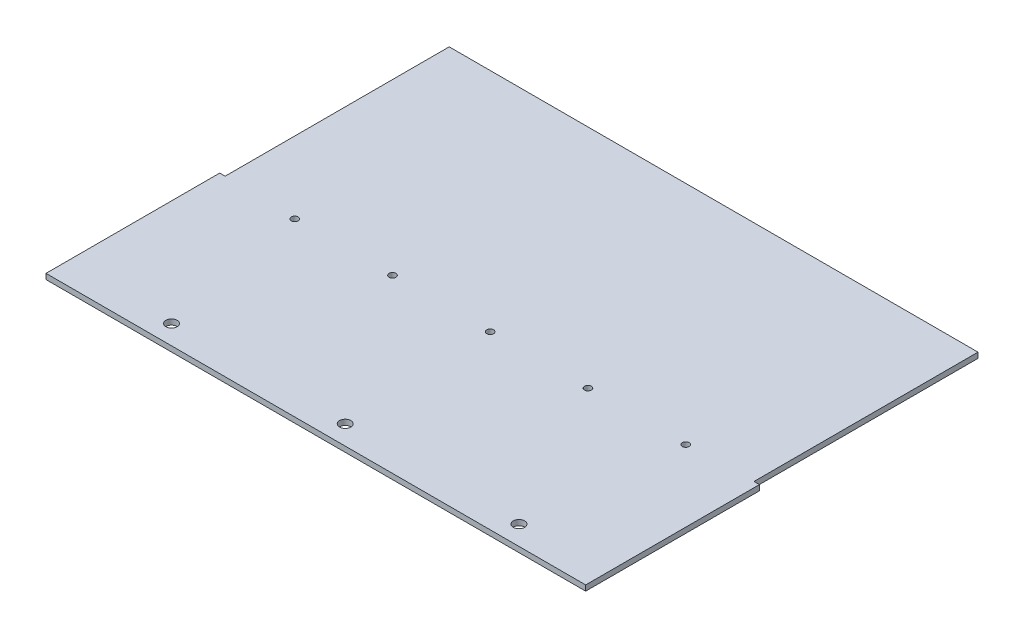
from build123d import *

# Parameters (mm, degrees)
SKETCH1_W           = 315.58
SKETCH1_H           = 3.175
BOSS_EXTRUDE1_DEPTH = 232.600000128
SKETCH5_W           = 3.175
SKETCH5_H           = 130.999992
CUT_EXTRUDE2_DEPTH  = 282.088108579
SKETCH7_R           = 3.302
CUT_EXTRUDE3_DEPTH  = 282.088108579
LPATTERN1_COUNT     = 3
LPATTERN1_PITCH     = 101.6
SKETCH8_R           = 2
CUT_EXTRUDE4_DEPTH  = 282.088108579
LPATTERN2_COUNT     = 5
LPATTERN2_PITCH     = 57.15


with BuildPart() as part:
    # Sketch1 → Boss-Extrude1 (new body)
    with BuildSketch(Plane.XY):
        Rectangle(SKETCH1_W, SKETCH1_H)
    extrude(amount=BOSS_EXTRUDE1_DEPTH)

    # Sketch5 → Cut-Extrude2 (cut, symmetric)
    with BuildSketch(Plane(origin=(0, 1.5875, 0), x_dir=(1, 0, 0), z_dir=(0, 1, 0))):
        with Locations((-156.2025, -65.499996)):
            Rectangle(SKETCH5_W, SKETCH5_H)
    cut_extrude2 = extrude(amount=CUT_EXTRUDE2_DEPTH, both=True, mode=Mode.SUBTRACT)

    # Mirror1: Cut-Extrude2 across plane
    add(cut_extrude2.mirror(Plane(origin=(0, 0, 0), x_dir=(0, 0, 1), z_dir=(1, 0, 0))), mode=Mode.SUBTRACT)

    # Sketch7 → Cut-Extrude3 (cut, through all)
    with BuildSketch(Plane.XZ.offset(1.5875)):
        with Locations((107.495393219, 221.30835)):
            Circle(SKETCH7_R)
    cut_extrude3 = extrude(amount=-CUT_EXTRUDE3_DEPTH, mode=Mode.SUBTRACT)

    # LPattern1: Cut-Extrude3 ×3
    with Locations(*[(-i * LPATTERN1_PITCH, 0, 0) for i in range(1, LPATTERN1_COUNT)]):
        add(cut_extrude3, mode=Mode.SUBTRACT)

    # Sketch8 → Cut-Extrude4 (cut, through all)
    with BuildSketch(Plane.XZ.offset(1.5875)):
        with Locations((-112.632892956, 132.28750022)):
            Circle(SKETCH8_R)
    cut_extrude4 = extrude(amount=-CUT_EXTRUDE4_DEPTH, mode=Mode.SUBTRACT)

    # LPattern2: Cut-Extrude4 ×5
    with Locations(*[(i * LPATTERN2_PITCH, 0, 0) for i in range(1, LPATTERN2_COUNT)]):
        add(cut_extrude4, mode=Mode.SUBTRACT)


solid = part.part
